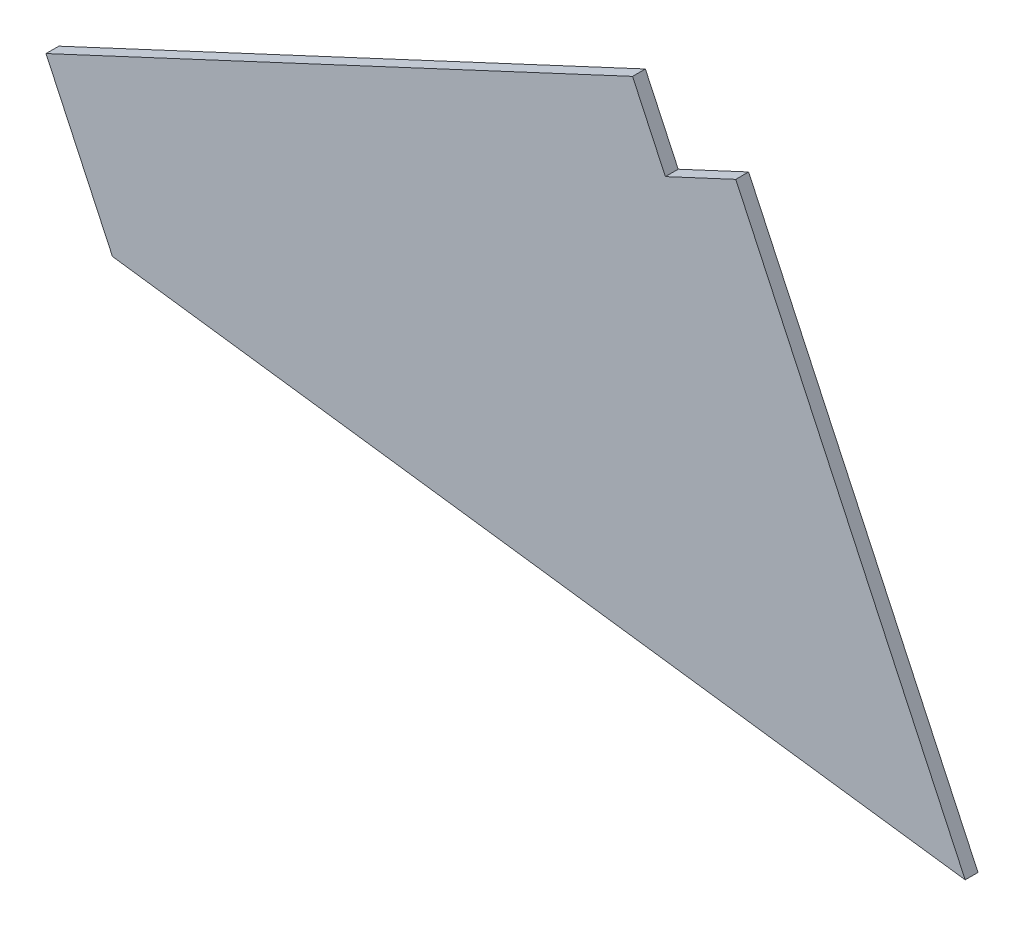
from build123d import *

# Parameters (mm, degrees)
BOSS_EXTRUDE1_DEPTH = 3.3


with BuildPart() as part:
    # Sketch1 → Boss-Extrude1 (new body)
    with BuildSketch(Plane.XY):
        Polygon((344.846056087, -37.332052475), (125.280696375, -8.107729541), (108.169003487, 28.58841428), (259.198908878, 99.014815774), (267.651274112, 80.888660034), (285.777429853, 89.341025269), align=None)
    extrude(amount=-BOSS_EXTRUDE1_DEPTH)


solid = part.part
